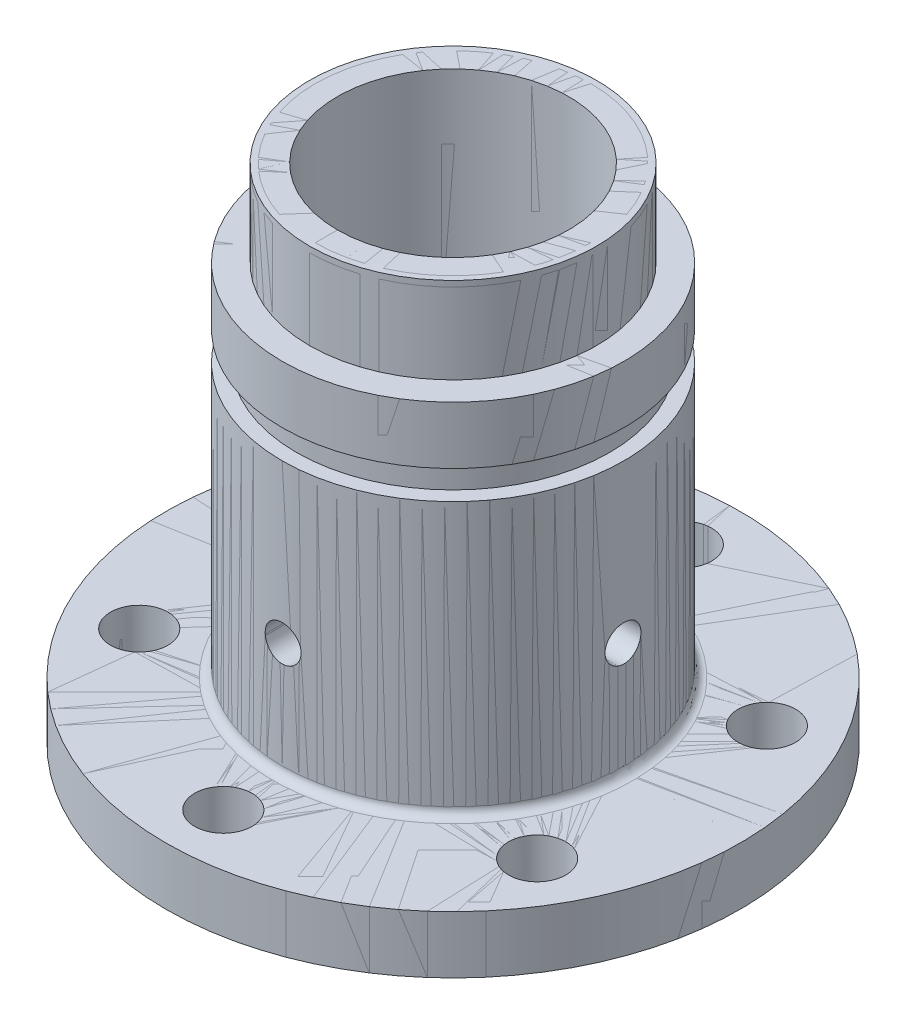
from build123d import *

# Parameters (mm, degrees)
SKETCH6_R          = 3.175
CUT_EXTRUDE2_DEPTH = 115.3
CIRPATTERN3_COUNT  = 4
FILLET1_R          = 1.524
CHAMFER1_SIZE      = 3.048
CHAMFER2_SIZE      = 1.016
SKETCH3_R          = 5.08
CUT_EXTRUDE1_DEPTH = 10.16


# Read off the part's stored shape, not the designer's step: Revolve1
with BuildPart() as part:
    # Revolve1 outline → Revolve1 (revolve)
    with BuildSketch(Plane.XY):
        Polygon((15.875, 40.64), (15.875, 20.32), (20.066, 20.32), (20.066, 13.97), (15.875, 13.97), (15.875, 0), (50.8, 0), (50.8, 10.16), (30.226, 10.16), (30.226, 58.42), (27.686, 58.42), (27.686, 63.5), (30.226, 63.5), (30.226, 73.66), (25.4, 73.66), (25.4, 88.9), (20.447, 88.9), (20.447, 50.8), align=None)
    revolve(axis=Axis((0, 0, 0), (0, 1, 0)))


with BuildPart() as body_2:
    # Revolve1 2 outline → Revolve1 2 (revolve)
    with BuildSketch(Plane.XY):
        Polygon((15.875, 40.64), (15.875, 20.32), (20.066, 20.32), (20.066, 13.97), (15.875, 13.97), (15.875, 0), (50.8, 0), (50.8, 10.16), (30.226, 10.16), (30.226, 58.42), (27.686, 58.42), (27.686, 63.5), (30.226, 63.5), (30.226, 73.66), (25.4, 73.66), (25.4, 88.9), (20.447, 88.9), (20.447, 50.8), align=None)
    revolve(axis=Axis((0, 0, 0), (0, 1, 0)))


with BuildPart() as cut_extrude2_tool:
    # Sketch6 → Cut-Extrude2 (new, through all)
    with BuildSketch(Plane.XY):
        with Locations((0, 30.48)):
            Circle(SKETCH6_R)
    cut_extrude2 = extrude(amount=-CUT_EXTRUDE2_DEPTH)


with BuildPart() as part_1:
    add(part.part)

    # Cut-Extrude2: cut by cut_extrude2_tool
    add(cut_extrude2_tool.part, mode=Mode.SUBTRACT)


with BuildPart() as body_2_1:
    add(body_2.part)

    # Cut-Extrude2: cut by cut_extrude2_tool
    add(cut_extrude2_tool.part, mode=Mode.SUBTRACT)


with BuildPart() as cirpattern3_tool:
    # CirPattern3: Cut-Extrude2 ×4 about axis
    cirpattern3_axis = Axis((0, 88.9, 0), (0, 1, 0))
    for i in range(1, CIRPATTERN3_COUNT):
        add(cut_extrude2.rotate(cirpattern3_axis, i * 360 / CIRPATTERN3_COUNT))


with BuildPart() as part_2:
    add(part_1.part)

    # CirPattern3: cut by cirpattern3_tool
    add(cirpattern3_tool.part, mode=Mode.SUBTRACT)

    # Fillet1
    fillet1_edges = [part_2.edges().sort_by_distance(p)[0] for p in [
        (-30.226, 10.16, 0),
    ]]
    fillet(fillet1_edges, radius=FILLET1_R)

    # Chamfer1
    chamfer1_edges = [part_2.edges().sort_by_distance(p)[0] for p in [
        (-15.875, 0, 0),
    ]]
    chamfer(chamfer1_edges, length=CHAMFER1_SIZE)

    # Chamfer2
    chamfer2_edges = [part_2.edges().sort_by_distance(p)[0] for p in [
        (-25.4, 88.9, 0),
    ]]
    chamfer(chamfer2_edges, length=CHAMFER2_SIZE)


with BuildPart() as body_2_2:
    add(body_2_1.part)

    # CirPattern3: cut by cirpattern3_tool
    add(cirpattern3_tool.part, mode=Mode.SUBTRACT)


with BuildPart() as cut_extrude1_tool:
    # Sketch3 → Cut-Extrude1 (new body)
    with BuildSketch(Plane(origin=(0, 0, 0), x_dir=(1, 0, 0), z_dir=(0, 1, 0))):
        with Locations(Location((35.19527241, -20.32, 0), (0, 0, 90))):
            Circle(SKETCH3_R)
        with Locations(Location((-35.19527241, 20.32, 0), (0, 0, 90))):
            Circle(SKETCH3_R)
        with Locations(Location((-35.19527241, -20.32, 0), (0, 0, 90))):
            Circle(SKETCH3_R)
        with Locations(Location((0, -40.64, 0), (0, 0, 90))):
            Circle(SKETCH3_R)
        with Locations(Location((35.19527241, 20.32, 0), (0, 0, 90))):
            Circle(SKETCH3_R)
        with Locations(Location((0, 40.64, 0), (0, 0, 90))):
            Circle(SKETCH3_R)
    extrude(amount=CUT_EXTRUDE1_DEPTH)


with BuildPart() as part_3:
    add(part_2.part)

    # Cut-Extrude1: cut by cut_extrude1_tool
    add(cut_extrude1_tool.part, mode=Mode.SUBTRACT)


with BuildPart() as body_2_3:
    add(body_2_2.part)

    # Cut-Extrude1: cut by cut_extrude1_tool
    add(cut_extrude1_tool.part, mode=Mode.SUBTRACT)


solid = Compound([part_3.part, body_2_3.part])
